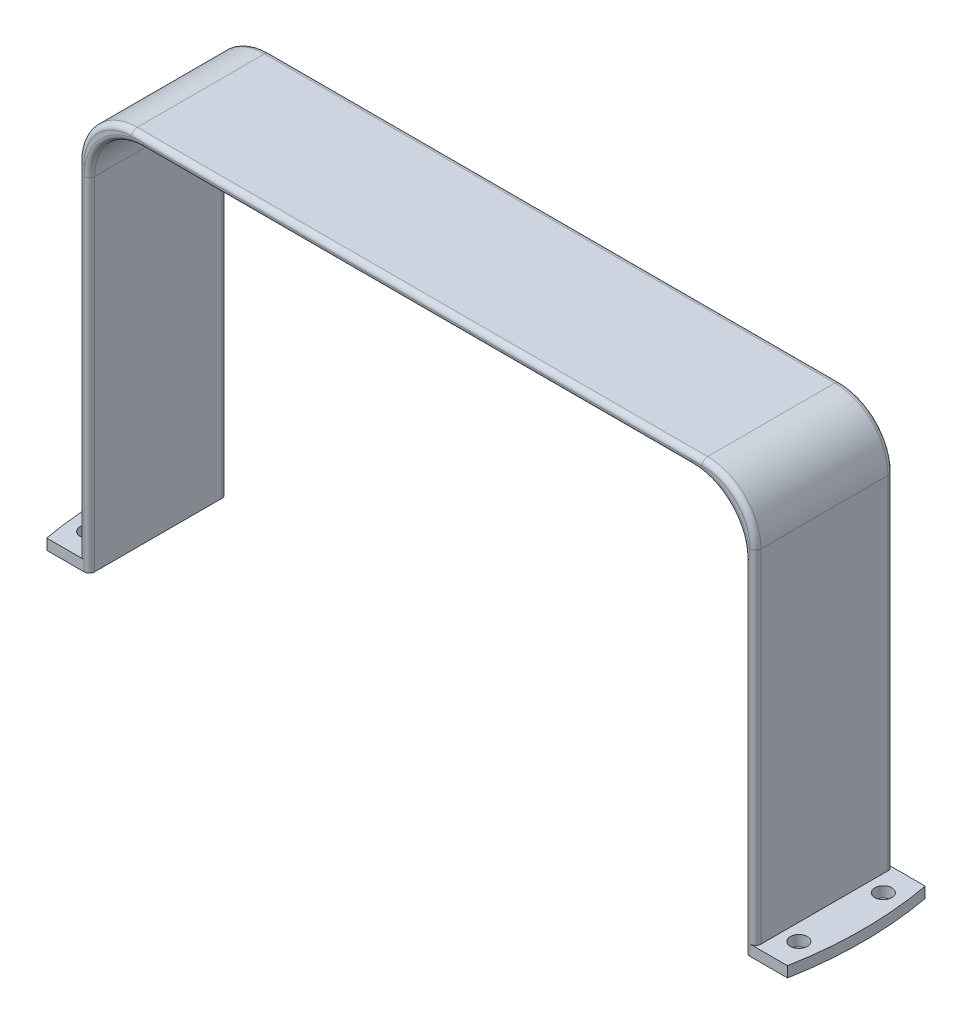
from build123d import *

# Parameters (mm, degrees)
SKETCH1_R            = 1.5875
BOSS_EXTRUDE5_DEPTH  = 1.5875
FILLET2_R            = 2.54
FILLET3_R            = 2.54
FILLET4_R            = 5.08
CUT_EXTRUDE1_START   = -2.54
SKETCH2_R            = 2.38125
SKETCH2_R_2          = 1.5875
CUT_EXTRUDE1_DEPTH   = 2.54
SKETCH3_R            = 1.5875
CUT_EXTRUDE2_DEPTH   = 2.54
CUT_EXTRUDE3_DEPTH   = 2.54
SKETCH5_W            = 15
SKETCH5_H            = 34.925
CUT_EXTRUDE4_DEPTH   = 109.650407999
FILLET5_R            = 7.62
FILLET6_R            = 7.62
BOSS_EXTRUDE6_START  = -1.5875
BOSS_EXTRUDE6_DEPTH  = 1.5875
SKETCH7_R            = 79.375
CUT_EXTRUDE5_DEPTH   = 0.5875
BOSS_EXTRUDE7_START  = -1
SKETCH8_R            = 1.5875
SKETCH8_R_2          = 2.38125
BOSS_EXTRUDE7_DEPTH  = 1
SKETCH9_R            = 1.5875
CUT_EXTRUDE7_DEPTH   = 2.54
BOSS_EXTRUDE8_START  = -1
BOSS_EXTRUDE8_DEPTH  = 1
CUT_EXTRUDE9_START   = -2.54
CUT_EXTRUDE9_DEPTH   = 2.54
BOSS_EXTRUDE9_START  = -1
BOSS_EXTRUDE9_DEPTH  = 1
CUT_EXTRUDE10_START  = -2.54
CUT_EXTRUDE10_DEPTH  = 2.54
BOSS_EXTRUDE10_START = -1
BOSS_EXTRUDE10_DEPTH = 1
CUT_EXTRUDE11_START  = -2.54
CUT_EXTRUDE11_DEPTH  = 2.54
BOSS_EXTRUDE11_START = -1
BOSS_EXTRUDE11_DEPTH = 1
SKETCH18_R           = 1.598696058
BOSS_EXTRUDE14_DEPTH = 2
SKETCH22_W           = 2
SKETCH22_H           = 25.839848816
BOSS_EXTRUDE16_DEPTH = 76.2
SKETCH23_W           = 122.93821768
SKETCH23_H           = 25.839848816
BOSS_EXTRUDE17_DEPTH = 2
FILLET7_R            = 10
CUT_EXTRUDE12_START  = -2
SKETCH24_R           = 79.375
CUT_EXTRUDE12_DEPTH  = 2
FILLET11_R           = 1
FILLET12_R           = 1


# Some blends are built 0.0001 mm under size
with BuildPart() as part:
    # Sketch1 → Boss-Extrude5 (new body)
    with BuildSketch(Plane(origin=(0, 0, 0), x_dir=(1, 0, 0), z_dir=(0, 1, 0))):
        with BuildLine():
            ThreePointArc((-63.5, -47.625), (-35.497579143, -70.995158286), (0, -79.375))
            ThreePointArc((0, -79.375), (35.497579143, -70.995158286), (63.5, -47.625))
            Line((63.5, -47.625), (50.8, -47.625))
            Line((50.8, -47.625), (50.8, 22.225))
            Line((50.8, 22.225), (76.2, 22.225))
            ThreePointArc((76.2, 22.225), (0, 79.375), (-76.2, 22.225))
            Line((-76.2, 22.225), (-50.8, 22.225))
            Line((-50.8, 22.225), (-50.8, -47.625))
            Line((-50.8, -47.625), (-63.5, -47.625))
        make_face()
        with Locations(Location((-7.14375, -66.675, 0), (0, 0, 270))):
            Circle(SKETCH1_R, mode=Mode.SUBTRACT)
        with BuildLine():
            ThreePointArc((8.73125, -66.675), (7.14375, -68.2625), (5.55625, -66.675))
            ThreePointArc((5.55625, -66.675), (7.14375, -65.0875), (8.73125, -66.675))
        make_face(mode=Mode.SUBTRACT)
        with Locations(Location((-7.14375, 66.675, 0), (0, 0, 270))):
            Circle(SKETCH1_R, mode=Mode.SUBTRACT)
        with Locations(Location((7.14375, 66.675, 0), (0, 0, 270))):
            Circle(SKETCH1_R, mode=Mode.SUBTRACT)
    extrude(amount=BOSS_EXTRUDE5_DEPTH)

    # Fillet2
    fillet2_edges = [part.edges().sort_by_distance(p)[0] for p in [
        (-63.5, 0.79375, 47.625),
    ]]
    fillet(fillet2_edges, radius=FILLET2_R)

    # Fillet3
    fillet3_edges = [part.edges().sort_by_distance(p)[0] for p in [
        (63.5, 0.79375, 47.625),
    ]]
    fillet(fillet3_edges, radius=FILLET3_R)

    # Fillet4
    fillet4_edges = [part.edges().sort_by_distance(p)[0] for p in [
        (-76.2, 0.79375, -22.225),
        (76.2, 0.79375, -22.225),
    ]]
    fillet(fillet4_edges, radius=FILLET4_R)

    # Sketch2 → Cut-Extrude1 (cut)
    # profile 1 of 10: a face of its own
    with BuildSketch(Plane(origin=(0, 1.5875, 0), x_dir=(1, 0, 0), z_dir=(0, 1, 0)).offset(CUT_EXTRUDE1_START)):
        with BuildLine():
            Line((-61.088622125, 27.654457796), (-59.642408406, 26.999765402))
            ThreePointArc((-59.642408406, 26.999765402), (-52.384826382, 39.268743005), (-42.643785254, 49.676068599))
            Line((-42.643785254, 49.676068599), (-43.677815048, 50.880617741))
            Line((-43.677815048, 50.880617741), (-44.711844841, 52.085166883))
            ThreePointArc((-44.711844841, 52.085166883), (-54.925289002, 41.173126022), (-62.534835843, 28.309150189))
            Line((-62.534835843, 28.309150189), (-61.088622125, 27.654457796))
        make_face()
    # profile 2 of 10: a face of its own
    with BuildSketch(Plane(origin=(0, 1.5875, 0), x_dir=(1, 0, 0), z_dir=(0, 1, 0)).offset(CUT_EXTRUDE1_START)):
        with BuildLine():
            Line((-39.077069744, 54.493774041), (-38.151958122, 53.203686937))
            ThreePointArc((-38.151958122, 53.203686937), (-25.732218917, 60.200142208), (-12.092567045, 64.342629994))
            Line((-12.092567045, 64.342629994), (-12.385788543, 65.902815048))
            Line((-12.385788543, 65.902815048), (-12.679010041, 67.463000102))
            ThreePointArc((-12.679010041, 67.463000102), (-26.980132574, 63.119617589), (-40.002181367, 55.783861145))
            Line((-40.002181367, 55.783861145), (-39.077069744, 54.493774041))
        make_face()
    # profile 3 of 10: a face of its own
    with BuildSketch(Plane(origin=(0, 1.5875, 0), x_dir=(1, 0, 0), z_dir=(0, 1, 0)).offset(CUT_EXTRUDE1_START)):
        with Locations(Location((-7.14375, 66.675, 0), (0, 0, 270))):
            Circle(SKETCH2_R)
        with Locations((-7.14375, 66.675)):
            Circle(SKETCH2_R_2, mode=Mode.SUBTRACT)
    # profile 4 of 10: a face of its own
    with BuildSketch(Plane(origin=(0, 1.5875, 0), x_dir=(1, 0, 0), z_dir=(0, 1, 0)).offset(CUT_EXTRUDE1_START)):
        with Locations(Location((7.14375, 66.675, 0), (0, 0, 270))):
            Circle(SKETCH2_R)
        with Locations((7.14375, 66.675)):
            Circle(SKETCH2_R_2, mode=Mode.SUBTRACT)
    # profile 5 of 10: a face of its own
    with BuildSketch(Plane(origin=(0, 1.5875, 0), x_dir=(1, 0, 0), z_dir=(0, 1, 0)).offset(CUT_EXTRUDE1_START)):
        with BuildLine():
            ThreePointArc((12.679010041, 67.463000102), (26.980132574, 63.119617589), (40.002181367, 55.783861145))
            Line((40.002181367, 55.783861145), (39.077069744, 54.493774041))
            Line((39.077069744, 54.493774041), (38.151958122, 53.203686937))
            ThreePointArc((38.151958122, 53.203686937), (25.732218917, 60.200142208), (12.092567045, 64.342629994))
            Line((12.092567045, 64.342629994), (12.385788543, 65.902815048))
            Line((12.385788543, 65.902815048), (12.679010041, 67.463000102))
        make_face()
    # profile 6 of 10: a face of its own
    with BuildSketch(Plane(origin=(0, 1.5875, 0), x_dir=(1, 0, 0), z_dir=(0, 1, 0)).offset(CUT_EXTRUDE1_START)):
        with BuildLine():
            ThreePointArc((44.711844841, 52.085166883), (54.925289002, 41.173126022), (62.534835843, 28.309150189))
            Line((62.534835843, 28.309150189), (59.642408406, 26.999765402))
            ThreePointArc((59.642408406, 26.999765402), (52.384826382, 39.268743005), (42.643785254, 49.676068599))
            Line((42.643785254, 49.676068599), (43.677815048, 50.880617741))
            Line((43.677815048, 50.880617741), (44.711844841, 52.085166883))
        make_face()
    # profile 7 of 10: a face of its own
    with BuildSketch(Plane(origin=(0, 1.5875, 0), x_dir=(1, 0, 0), z_dir=(0, 1, 0)).offset(CUT_EXTRUDE1_START)):
        with BuildLine():
            ThreePointArc((-12.679010041, -67.463000102), (-26.980132574, -63.119617589), (-40.002181367, -55.783861145))
            Line((-40.002181367, -55.783861145), (-39.077069744, -54.493774041))
            Line((-39.077069744, -54.493774041), (-38.151958122, -53.203686937))
            ThreePointArc((-38.151958122, -53.203686937), (-25.732218917, -60.200142208), (-12.092567045, -64.342629994))
            Line((-12.092567045, -64.342629994), (-12.385788543, -65.902815048))
            Line((-12.385788543, -65.902815048), (-12.679010041, -67.463000102))
        make_face()
    # profile 8 of 10: a face of its own
    with BuildSketch(Plane(origin=(0, 1.5875, 0), x_dir=(1, 0, 0), z_dir=(0, 1, 0)).offset(CUT_EXTRUDE1_START)):
        with Locations(Location((-7.14375, -66.675, 0), (0, 0, 270))):
            Circle(SKETCH2_R)
        with Locations((-7.14375, -66.675)):
            Circle(SKETCH2_R_2, mode=Mode.SUBTRACT)
    # profile 9 of 10: a face of its own
    with BuildSketch(Plane(origin=(0, 1.5875, 0), x_dir=(1, 0, 0), z_dir=(0, 1, 0)).offset(CUT_EXTRUDE1_START)):
        with Locations(Location((7.14375, -66.675, 0), (0, 0, 270))):
            Circle(SKETCH2_R)
        with Locations((7.14375, -66.675)):
            Circle(SKETCH2_R_2, mode=Mode.SUBTRACT)
    # profile 10 of 10: a face of its own
    with BuildSketch(Plane(origin=(0, 1.5875, 0), x_dir=(1, 0, 0), z_dir=(0, 1, 0)).offset(CUT_EXTRUDE1_START)):
        with BuildLine():
            ThreePointArc((12.092567045, -64.342629994), (25.732218917, -60.200142208), (38.151958122, -53.203686937))
            Line((38.151958122, -53.203686937), (39.077069744, -54.493774041))
            Line((39.077069744, -54.493774041), (40.002181367, -55.783861145))
            ThreePointArc((40.002181367, -55.783861145), (26.980132574, -63.119617589), (12.679010041, -67.463000102))
            Line((12.679010041, -67.463000102), (12.385788543, -65.902815048))
            Line((12.385788543, -65.902815048), (12.092567045, -64.342629994))
        make_face()
    extrude(amount=CUT_EXTRUDE1_DEPTH, mode=Mode.SUBTRACT)

    # Sketch3 → Cut-Extrude2 (cut)
    with BuildSketch(Plane(origin=(0, 1.5875, 0), x_dir=(1, 0, 0), z_dir=(0, 1, 0))):
        with Locations(Location((-44.45, -47.625, 0), (0, 0, 270))):
            Circle(SKETCH3_R)
        with Locations(Location((-44.45, 22.225, 0), (0, 0, 270))):
            Circle(SKETCH3_R)
        with Locations(Location((44.45, 22.225, 0), (0, 0, 270))):
            Circle(SKETCH3_R)
        with Locations(Location((44.45, -47.625, 0), (0, 0, 270))):
            Circle(SKETCH3_R)
    extrude(amount=-CUT_EXTRUDE2_DEPTH, mode=Mode.SUBTRACT)

    # Sketch4 → Cut-Extrude3 (cut)
    with BuildSketch(Plane(origin=(0, 1.5875, 0), x_dir=(1, 0, 0), z_dir=(0, 1, 0))):
        with BuildLine():
            ThreePointArc((-44.45, -11.1125), (-46.0375, -12.7), (-44.45, -14.2875))
            Line((-44.45, -14.2875), (-44.45, -11.1125))
        make_face()
        with BuildLine():
            Line((-44.45, -11.1125), (-44.45, -14.2875))
            ThreePointArc((-44.45, -14.2875), (-43.327467985, -13.822532015), (-42.8625, -12.7))
            ThreePointArc((-42.8625, -12.7), (-43.327467985, -11.577467985), (-44.45, -11.1125))
        make_face()
        with BuildLine():
            ThreePointArc((44.45, -11.1125), (42.8625, -12.7), (44.45, -14.2875))
            Line((44.45, -14.2875), (44.45, -11.1125))
        make_face()
        with BuildLine():
            Line((44.45, -11.1125), (44.45, -14.2875))
            ThreePointArc((44.45, -14.2875), (45.572532015, -13.822532015), (46.0375, -12.7))
            ThreePointArc((46.0375, -12.7), (45.572532015, -11.577467985), (44.45, -11.1125))
        make_face()
    extrude(amount=-CUT_EXTRUDE3_DEPTH, mode=Mode.SUBTRACT)

    # Sketch5 → Cut-Extrude4 (cut, through all)
    with BuildSketch(Plane(origin=(0, 1.5875, 0), x_dir=(1, 0, 0), z_dir=(0, 1, 0))):
        with Locations((-27.3, 4.7625)):
            Rectangle(SKETCH5_W, SKETCH5_H)
        with Locations((27.3, 4.7625)):
            Rectangle(SKETCH5_W, SKETCH5_H)
    extrude(amount=-CUT_EXTRUDE4_DEPTH, mode=Mode.SUBTRACT)

    # Fillet5
    # the kernel refuses this fillet: 7.62 mm, written as the material it adds along each edge
    with BuildSketch(Plane(origin=(-19.8, 1.5875, 12.7), x_dir=(0, 0, -1), z_dir=(0, -1, 0))) as fillet5_piece_1:
        with BuildLine():
            CenterArc((FILLET5_R, -FILLET5_R), FILLET5_R, 90, 90)
            Line((0, -FILLET5_R), (0, 0))
            Line((0, 0), (FILLET5_R, 0))
        make_face()
    extrude(amount=1.5875)
    with BuildSketch(Plane(origin=(-34.8, 1.5875, 12.7), x_dir=(0, 0, -1), z_dir=(0, -1, 0)), Plane(origin=(-19.8, 1.5875, -22.225), x_dir=(0, 0, 1), z_dir=(0, -1, 0)), Plane(origin=(-34.8, 1.5875, -22.225), x_dir=(1, 0, 0), z_dir=(0, -1, 0))) as fillet5_piece_2:
        with BuildLine():
            CenterArc((FILLET5_R, FILLET5_R), FILLET5_R, 180, 90)
            Line((0, FILLET5_R), (0, 0))
            Line((0, 0), (FILLET5_R, 0))
        make_face()
    extrude(amount=1.5875)

    # Fillet6
    # the kernel refuses this fillet: 7.62 mm, written as the material it adds along each edge
    with BuildSketch(Plane(origin=(34.8, 1.5875, 12.7), x_dir=(0, 0, -1), z_dir=(0, -1, 0)), Plane(origin=(34.8, 1.5875, -22.225), x_dir=(-1, 0, 0), z_dir=(0, -1, 0))) as fillet6_piece_1:
        with BuildLine():
            CenterArc((FILLET6_R, -FILLET6_R), FILLET6_R, 90, 90)
            Line((0, -FILLET6_R), (0, 0))
            Line((0, 0), (FILLET6_R, 0))
        make_face()
    extrude(amount=1.5875)
    with BuildSketch(Plane(origin=(19.8, 1.5875, -22.225), x_dir=(1, 0, 0), z_dir=(0, -1, 0)), Plane(origin=(19.8, 1.5875, 12.7), x_dir=(0, 0, -1), z_dir=(0, -1, 0))) as fillet6_piece_2:
        with BuildLine():
            CenterArc((FILLET6_R, FILLET6_R), FILLET6_R, 180, 90)
            Line((0, FILLET6_R), (0, 0))
            Line((0, 0), (FILLET6_R, 0))
        make_face()
    extrude(amount=1.5875)

    # Sketch6 → Boss-Extrude6 (add)
    with BuildSketch(Plane(origin=(0, 1.5875, 0), x_dir=(1, 0, 0), z_dir=(0, 1, 0)).offset(BOSS_EXTRUDE6_START)):
        with BuildLine():
            Line((-50.8, -60.989758362), (-50.8, 22.225))
            Line((-50.8, 22.225), (-69.095470184, 22.225))
            Line((-69.095470184, 22.225), (-69.095470184, 39.066694575))
            ThreePointArc((-69.095470184, 39.066694575), (-78.080435361, -14.277122916), (-50.8, -60.989758362))
        make_face()
        with BuildLine():
            Line((50.8, 22.225), (50.8, -60.989758362))
            ThreePointArc((50.8, -60.989758362), (71.877119534, -33.675960454), (79.375, 0))
            ThreePointArc((79.375, 0), (76.762111653, 20.198238526), (69.095470184, 39.066694575))
            Line((69.095470184, 39.066694575), (69.095470184, 22.225))
            Line((69.095470184, 22.225), (50.8, 22.225))
        make_face()
    extrude(amount=BOSS_EXTRUDE6_DEPTH)

    # Sketch7 → Cut-Extrude5 (cut)
    with BuildSketch(Plane.XZ):
        with Locations(Location((0, 0, 0), (0, 0, 270))):
            Circle(SKETCH7_R)
    extrude(amount=-CUT_EXTRUDE5_DEPTH, mode=Mode.SUBTRACT)

    # Sketch8 → Boss-Extrude7 (add)
    with BuildSketch(Plane(origin=(0, 1.5875, 0), x_dir=(1, 0, 0), z_dir=(0, 1, 0)).offset(BOSS_EXTRUDE7_START)):
        with Locations((-44.45, -12.7)):
            Circle(SKETCH8_R)
        with Locations((44.45, -12.7)):
            Circle(SKETCH8_R)
        with Locations((-7.14375, -66.675)):
            Circle(SKETCH8_R_2)
        with Locations((7.14375, -66.675)):
            Circle(SKETCH8_R_2)
        with Locations((-7.14375, 66.675)):
            Circle(SKETCH8_R_2)
        with Locations((7.14375, 66.675)):
            Circle(SKETCH8_R_2)
    extrude(amount=BOSS_EXTRUDE7_DEPTH)

    # Sketch9 → Cut-Extrude7 (cut)
    with BuildSketch(Plane(origin=(0, 1.5875, 0), x_dir=(1, 0, 0), z_dir=(0, 1, 0))):
        with Locations(Location((-44.45, -1.058333333, 0), (0, 0, 270))):
            Circle(SKETCH9_R)
        with Locations(Location((-44.45, -24.341666667, 0), (0, 0, 270))):
            Circle(SKETCH9_R)
        with Locations(Location((44.45, -24.341666667, 0), (0, 0, 270))):
            Circle(SKETCH9_R)
        with Locations(Location((44.45, -1.058333333, 0), (0, 0, 270))):
            Circle(SKETCH9_R)
    extrude(amount=-CUT_EXTRUDE7_DEPTH, mode=Mode.SUBTRACT)

    # Sketch10 → Boss-Extrude8 (add)
    with BuildSketch(Plane(origin=(0, 1.5875, 0), x_dir=(1, 0, 0), z_dir=(0, 1, 0)).offset(BOSS_EXTRUDE8_START)):
        with BuildLine():
            Line((-44.711844841, 52.085166883), (-42.643785254, 49.676068599))
            ThreePointArc((-42.643785254, 49.676068599), (-52.384826382, 39.268743005), (-59.642408406, 26.999765402))
            Line((-59.642408406, 26.999765402), (-62.534835843, 28.309150189))
            ThreePointArc((-62.534835843, 28.309150189), (-54.925289002, 41.173126022), (-44.711844841, 52.085166883))
        make_face()
        with BuildLine():
            Line((-12.679010041, 67.463000102), (-12.092567045, 64.342629994))
            ThreePointArc((-12.092567045, 64.342629994), (-25.732218917, 60.200142208), (-38.151958122, 53.203686937))
            Line((-38.151958122, 53.203686937), (-40.002181367, 55.783861145))
            ThreePointArc((-40.002181367, 55.783861145), (-26.980132574, 63.119617589), (-12.679010041, 67.463000102))
        make_face()
        with BuildLine():
            Line((12.092567045, 64.342629994), (12.679010041, 67.463000102))
            ThreePointArc((12.679010041, 67.463000102), (26.980132574, 63.119617589), (40.002181367, 55.783861145))
            Line((40.002181367, 55.783861145), (38.151958122, 53.203686937))
            ThreePointArc((38.151958122, 53.203686937), (25.732218917, 60.200142208), (12.092567045, 64.342629994))
        make_face()
        with BuildLine():
            Line((42.643785254, 49.676068599), (44.711844841, 52.085166883))
            ThreePointArc((44.711844841, 52.085166883), (54.925289002, 41.173126022), (62.534835843, 28.309150189))
            Line((62.534835843, 28.309150189), (59.642408406, 26.999765402))
            ThreePointArc((59.642408406, 26.999765402), (52.384826382, 39.268743005), (42.643785254, 49.676068599))
        make_face()
    extrude(amount=BOSS_EXTRUDE8_DEPTH)

    # Sketch11 → Cut-Extrude9 (cut)
    with BuildSketch(Plane(origin=(0, 1.5875, 0), x_dir=(1, 0, 0), z_dir=(0, 1, 0)).offset(CUT_EXTRUDE9_START)):
        with BuildLine():
            Line((11.919924408, -67.601250584), (11.368591443, -64.474485968))
            ThreePointArc((11.368591443, -64.474485968), (0, -65.46910884), (-11.368591443, -64.474485968))
            Line((-11.368591443, -64.474485968), (-11.919924408, -67.601250584))
            ThreePointArc((-11.919924408, -67.601250584), (0, -68.64410884), (11.919924408, -67.601250584))
        make_face()
        with BuildLine():
            Line((-11.919924408, 67.601250584), (-11.368591443, 64.474485968))
            ThreePointArc((-11.368591443, 64.474485968), (0, 65.46910884), (11.368591443, 64.474485968))
            Line((11.368591443, 64.474485968), (11.919924408, 67.601250584))
            ThreePointArc((11.919924408, 67.601250584), (0, 68.64410884), (-11.919924408, 67.601250584))
        make_face()
        with BuildLine():
            Line((-48.538714849, 48.538714849), (-46.293650819, 46.293650819))
            ThreePointArc((-46.293650819, 46.293650819), (-42.082731979, 50.152247023), (-37.551538139, 53.629154344))
            Line((-37.551538139, 53.629154344), (-39.372643325, 56.229962084))
            ThreePointArc((-39.372643325, 56.229962084), (-44.12358264, 52.584438129), (-48.538714849, 48.538714849))
        make_face()
        with BuildLine():
            ThreePointArc((-53.629154344, 37.551538139), (-50.152247023, 42.082731979), (-46.293650819, 46.293650819))
            Line((-46.293650819, 46.293650819), (-48.538714849, 48.538714849))
            ThreePointArc((-48.538714849, 48.538714849), (-52.584438129, 44.12358264), (-56.229962084, 39.372643325))
            Line((-56.229962084, 39.372643325), (-53.629154344, 37.551538139))
        make_face()
        with BuildLine():
            Line((-68.64410884, 0), (-65.46910884, 0))
            ThreePointArc((-65.46910884, 0), (-65.219979115, 5.706008808), (-64.474485968, 11.368591443))
            Line((-64.474485968, 11.368591443), (-67.601250584, 11.919924408))
            ThreePointArc((-67.601250584, 11.919924408), (-68.382897281, 5.982728291), (-68.64410884, 0))
        make_face()
        with BuildLine():
            ThreePointArc((-64.474485968, -11.368591443), (-65.219979115, -5.706008808), (-65.46910884, 0))
            Line((-65.46910884, 0), (-68.64410884, 0))
            ThreePointArc((-68.64410884, 0), (-68.382897281, -5.982728291), (-67.601250584, -11.919924408))
            Line((-67.601250584, -11.919924408), (-64.474485968, -11.368591443))
        make_face()
        with BuildLine():
            Line((67.601250584, 11.919924408), (64.474485968, 11.368591443))
            ThreePointArc((64.474485968, 11.368591443), (65.219979115, 5.706008808), (65.46910884, 0))
            ThreePointArc((65.46910884, 0), (65.219979115, -5.706008808), (64.474485968, -11.368591443))
            Line((64.474485968, -11.368591443), (67.601250584, -11.919924408))
            ThreePointArc((67.601250584, -11.919924408), (68.382897281, -5.982728291), (68.64410884, 0))
            ThreePointArc((68.64410884, 0), (68.382897281, 5.982728291), (67.601250584, 11.919924408))
        make_face()
        with BuildLine():
            Line((48.538714849, 48.538714849), (46.293650819, 46.293650819))
            ThreePointArc((46.293650819, 46.293650819), (50.152247023, 42.082731979), (53.629154344, 37.551538139))
            Line((53.629154344, 37.551538139), (56.229962084, 39.372643325))
            ThreePointArc((56.229962084, 39.372643325), (52.584438129, 44.12358264), (48.538714849, 48.538714849))
        make_face()
        with BuildLine():
            ThreePointArc((37.551538139, 53.629154344), (42.082731979, 50.152247023), (46.293650819, 46.293650819))
            Line((46.293650819, 46.293650819), (48.538714849, 48.538714849))
            ThreePointArc((48.538714849, 48.538714849), (44.12358264, 52.584438129), (39.372643325, 56.229962084))
            Line((39.372643325, 56.229962084), (37.551538139, 53.629154344))
        make_face()
    extrude(amount=CUT_EXTRUDE9_DEPTH, mode=Mode.SUBTRACT)

    # Sketch12 → Boss-Extrude9 (add)
    with BuildSketch(Plane(origin=(0, 1.5875, 0), x_dir=(1, 0, 0), z_dir=(0, 1, 0)).offset(BOSS_EXTRUDE9_START)):
        with BuildLine():
            ThreePointArc((-12.092567045, -64.342629994), (-14.887643702, -63.753919701), (-17.654380884, -63.043850199))
            Line((-17.654380884, -63.043850199), (-18.510550462, -66.101234482))
            ThreePointArc((-18.510550462, -66.101234482), (-15.609637167, -66.845739624), (-12.679010041, -67.463000102))
            Line((-12.679010041, -67.463000102), (-12.092567045, -64.342629994))
        make_face()
        with BuildLine():
            Line((18.510550462, -66.101234482), (17.654380884, -63.043850199))
            ThreePointArc((17.654380884, -63.043850199), (14.887643702, -63.753919701), (12.092567045, -64.342629994))
            Line((12.092567045, -64.342629994), (12.679010041, -67.463000102))
            ThreePointArc((12.679010041, -67.463000102), (15.609637167, -66.845739624), (18.510550462, -66.101234482))
        make_face()
    extrude(amount=BOSS_EXTRUDE9_DEPTH)

    # Sketch13 → Cut-Extrude10 (cut)
    with BuildSketch(Plane(origin=(0, 1.5875, 0), x_dir=(1, 0, 0), z_dir=(0, 1, 0)).offset(CUT_EXTRUDE10_START)):
        with BuildLine():
            Line((-52.584438129, -44.12358264), (-50.152247023, -42.082731979))
            ThreePointArc((-50.152247023, -42.082731979), (-56.697911418, -32.73455442), (-61.520838466, -22.391753989))
            Line((-61.520838466, -22.391753989), (-64.504362537, -23.477667944))
            ThreePointArc((-64.504362537, -23.477667944), (-59.447542075, -34.32205442), (-52.584438129, -44.12358264))
        make_face()
        with BuildLine():
            Line((64.504362537, -23.477667944), (61.520838466, -22.391753989))
            ThreePointArc((61.520838466, -22.391753989), (56.697911418, -32.73455442), (50.152247023, -42.082731979))
            Line((50.152247023, -42.082731979), (52.584438129, -44.12358264))
            ThreePointArc((52.584438129, -44.12358264), (59.447542075, -34.32205442), (64.504362537, -23.477667944))
        make_face()
        with BuildLine():
            Line((52.584438129, 44.12358264), (50.152247023, 42.082731979))
            ThreePointArc((50.152247023, 42.082731979), (56.697911418, 32.73455442), (61.520838466, 22.391753989))
            Line((61.520838466, 22.391753989), (64.504362537, 23.477667944))
            ThreePointArc((64.504362537, 23.477667944), (59.447542075, 34.32205442), (52.584438129, 44.12358264))
        make_face()
        with BuildLine():
            Line((23.477667944, 64.504362537), (22.391753989, 61.520838466))
            ThreePointArc((22.391753989, 61.520838466), (32.73455442, 56.697911418), (42.082731979, 50.152247023))
            Line((42.082731979, 50.152247023), (44.12358264, 52.584438129))
            ThreePointArc((44.12358264, 52.584438129), (34.32205442, 59.447542075), (23.477667944, 64.504362537))
        make_face()
        with BuildLine():
            Line((-44.12358264, 52.584438129), (-42.082731979, 50.152247023))
            ThreePointArc((-42.082731979, 50.152247023), (-32.73455442, 56.697911418), (-22.391753989, 61.520838466))
            Line((-22.391753989, 61.520838466), (-23.477667944, 64.504362537))
            ThreePointArc((-23.477667944, 64.504362537), (-34.32205442, 59.447542075), (-44.12358264, 52.584438129))
        make_face()
        with BuildLine():
            Line((-64.504362537, 23.477667944), (-61.520838466, 22.391753989))
            ThreePointArc((-61.520838466, 22.391753989), (-56.697911418, 32.73455442), (-50.152247023, 42.082731979))
            Line((-50.152247023, 42.082731979), (-52.584438129, 44.12358264))
            ThreePointArc((-52.584438129, 44.12358264), (-59.447542075, 34.32205442), (-64.504362537, 23.477667944))
        make_face()
    extrude(amount=CUT_EXTRUDE10_DEPTH, mode=Mode.SUBTRACT)

    # Sketch15 → Boss-Extrude10 (add)
    with BuildSketch(Plane(origin=(0, 1.5875, 0), x_dir=(1, 0, 0), z_dir=(0, 1, 0)).offset(BOSS_EXTRUDE10_START)):
        with BuildLine():
            Line((-52.584438129, 44.12358264), (-50.152247023, 42.082731979))
            ThreePointArc((-50.152247023, 42.082731979), (-46.293650819, 46.293650819), (-42.082731979, 50.152247023))
            Line((-42.082731979, 50.152247023), (-44.12358264, 52.584438129))
            ThreePointArc((-44.12358264, 52.584438129), (-48.538714849, 48.538714849), (-52.584438129, 44.12358264))
        make_face()
        with BuildLine():
            Line((44.12358264, 52.584438129), (42.082731979, 50.152247023))
            ThreePointArc((42.082731979, 50.152247023), (46.293650819, 46.293650819), (50.152247023, 42.082731979))
            Line((50.152247023, 42.082731979), (52.584438129, 44.12358264))
            ThreePointArc((52.584438129, 44.12358264), (48.538714849, 48.538714849), (44.12358264, 52.584438129))
        make_face()
    extrude(amount=BOSS_EXTRUDE10_DEPTH)

    # Sketch16 → Cut-Extrude11 (cut)
    with BuildSketch(Plane(origin=(0, 1.5875, 0), x_dir=(1, 0, 0), z_dir=(0, 1, 0)).offset(CUT_EXTRUDE11_START)):
        with BuildLine():
            Line((-23.477667944, -64.504362537), (-22.391753989, -61.520838466))
            ThreePointArc((-22.391753989, -61.520838466), (-32.73455442, -56.697911418), (-42.082731979, -50.152247022))
            Line((-42.082731979, -50.152247022), (-44.12358264, -52.584438129))
            ThreePointArc((-44.12358264, -52.584438129), (-34.32205442, -59.447542075), (-23.477667944, -64.504362537))
        make_face()
        with BuildLine():
            ThreePointArc((42.082731979, -50.152247022), (32.73455442, -56.697911418), (22.391753989, -61.520838466))
            Line((22.391753989, -61.520838466), (23.477667944, -64.504362537))
            ThreePointArc((23.477667944, -64.504362537), (34.32205442, -59.447542075), (44.12358264, -52.584438129))
            Line((44.12358264, -52.584438129), (42.082731979, -50.152247022))
        make_face()
    extrude(amount=CUT_EXTRUDE11_DEPTH, mode=Mode.SUBTRACT)

    # Sketch17 → Boss-Extrude11 (add)
    with BuildSketch(Plane(origin=(0, 1.5875, 0), x_dir=(1, 0, 0), z_dir=(0, 1, 0)).offset(BOSS_EXTRUDE11_START)):
        with BuildLine():
            Line((-11.919924408, -67.601250584), (-11.368591443, -64.474485968))
            ThreePointArc((-11.368591443, -64.474485968), (-16.944652234, -63.238303052), (-22.391753989, -61.520838466))
            Line((-22.391753989, -61.520838466), (-23.477667944, -64.504362537))
            ThreePointArc((-23.477667944, -64.504362537), (-17.766402702, -66.305117551), (-11.919924408, -67.601250584))
        make_face()
        with BuildLine():
            ThreePointArc((22.391753989, -61.520838466), (16.944652234, -63.238303052), (11.368591443, -64.474485968))
            Line((11.368591443, -64.474485968), (11.919924408, -67.601250584))
            ThreePointArc((11.919924408, -67.601250584), (17.766402702, -66.305117551), (23.477667944, -64.504362537))
            Line((23.477667944, -64.504362537), (22.391753989, -61.520838466))
        make_face()
    extrude(amount=BOSS_EXTRUDE11_DEPTH)

    # Sketch18 → Boss-Extrude14 (add)
    # profile 1 of 2: a face of its own
    with BuildSketch(Plane(origin=(0, 1.5875, 0), x_dir=(1, 0, 0), z_dir=(0, 1, 0))):
        with BuildLine():
            Line((-69.452614544, 12.919924408), (-67.601250584, 12.919924408))
            Line((-67.601250584, 12.919924408), (-63.46910884, 12.919924408))
            Line((-63.46910884, 12.919924408), (-63.46910884, -12.919924408))
            Line((-63.46910884, -12.919924408), (-67.601250584, -12.919924408))
            Line((-67.601250584, -12.919924408), (-69.452614544, -12.919924408))
            ThreePointArc((-69.452614544, -12.919924408), (-70.64410884, 0), (-69.452614544, 12.919924408))
        make_face()
        with Locations(Location((-66.586995079, 7.919924408, 0), (0, 0, 166.43409685))):
            Circle(SKETCH18_R, mode=Mode.SUBTRACT)
        with Locations(Location((-66.586995079, -7.919924408, 0), (0, 0, 13.56590315))):
            Circle(SKETCH18_R, mode=Mode.SUBTRACT)
    # profile 2 of 2: a face of its own
    with BuildSketch(Plane(origin=(0, 1.5875, 0), x_dir=(1, 0, 0), z_dir=(0, 1, 0))):
        with BuildLine():
            Line((69.452614544, -12.919924408), (67.601250584, -12.919924408))
            Line((67.601250584, -12.919924408), (63.46910884, -12.919924408))
            Line((63.46910884, -12.919924408), (63.46910884, 12.919924408))
            Line((63.46910884, 12.919924408), (67.601250584, 12.919924408))
            Line((67.601250584, 12.919924408), (69.452614544, 12.919924408))
            ThreePointArc((69.452614544, 12.919924408), (70.64410884, 0), (69.452614544, -12.919924408))
        make_face()
        with Locations(Location((66.586995079, -7.919924408, 0), (0, 0, 166.43409685))):
            Circle(SKETCH18_R, mode=Mode.SUBTRACT)
        with Locations(Location((66.586995079, 7.919924408, 0), (0, 0, 13.56590315))):
            Circle(SKETCH18_R, mode=Mode.SUBTRACT)
    extrude(amount=BOSS_EXTRUDE14_DEPTH)

    # Sketch22 → Boss-Extrude16 (add)
    with BuildSketch(Plane(origin=(0, 1.5875, 0), x_dir=(1, 0, 0), z_dir=(0, 1, 0))):
        with Locations((-62.46910884, 0)):
            Rectangle(SKETCH22_W, SKETCH22_H)
        with Locations((62.46910884, 0)):
            Rectangle(SKETCH22_W, SKETCH22_H)
    extrude(amount=BOSS_EXTRUDE16_DEPTH)

    # Sketch23 → Boss-Extrude17 (add)
    with BuildSketch(Plane(origin=(0, 77.7875, 0), x_dir=(1, 0, 0), z_dir=(0, 1, 0))):
        Rectangle(SKETCH23_W, SKETCH23_H)
    extrude(amount=-BOSS_EXTRUDE17_DEPTH)

    # Fillet7
    fillet7_edges = [part.edges().sort_by_distance(p)[0] for p in [
        (-63.46910884, 77.7875, 0),
        (63.46910884, 77.7875, 0),
        (61.46910884, 75.7875, 0),
        (-61.46910884, 75.7875, 0),
    ]]
    fillet(fillet7_edges, radius=FILLET7_R)

    # Sketch24 → Cut-Extrude12 (cut)
    with BuildSketch(Plane(origin=(0, 1.5875, 0), x_dir=(1, 0, 0), z_dir=(0, 1, 0)).offset(CUT_EXTRUDE12_START)):
        Circle(SKETCH24_R)
    extrude(amount=CUT_EXTRUDE12_DEPTH, mode=Mode.SUBTRACT)

    # Fillet11
    fillet11_edges = [part.edges().sort_by_distance(p)[0] for p in [
        (63.46910884, 35.6875, 12.919924408),
        (0, 77.7875, 12.919924408),
        (61.46910884, 33.6875, 12.919924408),
        (0, 75.7875, 12.919924408),
        (-63.46910884, 35.6875, 12.919924408),
        (-61.46910884, 33.6875, 12.919924408),
        (58.540176651, 72.858567812, 12.919924408),
        (-58.540176651, 72.858567812, 12.919924408),
        (-60.540176651, 74.858567812, 12.919924408),
        (60.540176651, 74.858567812, 12.919924408),
    ]]
    fillet(fillet11_edges, radius=FILLET11_R - 0.0001)  # a hair under: the kernel refuses the full size

    # Fillet12
    fillet12_edges = [part.edges().sort_by_distance(p)[0] for p in [
        (63.46910884, 35.6875, -12.919924408),
        (0, 77.7875, -12.919924408),
        (61.46910884, 33.6875, -12.919924408),
        (0, 75.7875, -12.919924408),
        (-63.46910884, 35.6875, -12.919924408),
        (-61.46910884, 33.6875, -12.919924408),
        (58.540176651, 72.858567812, -12.919924408),
        (-58.540176651, 72.858567812, -12.919924408),
        (-60.540176651, 74.858567812, -12.919924408),
        (60.540176651, 74.858567812, -12.919924408),
    ]]
    fillet(fillet12_edges, radius=FILLET12_R - 0.0001)  # a hair under: the kernel refuses the full size


solid = part.part
